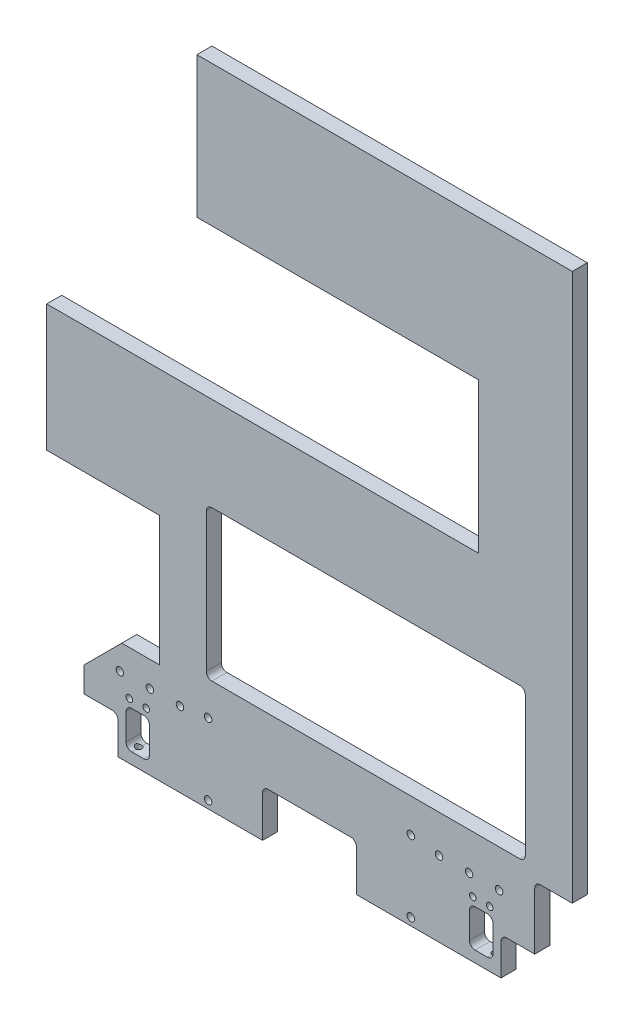
from build123d import *

# Parameters (mm, degrees)
ESQUISSE1_W              = 280
ESQUISSE1_H              = 45
BOSS_EXTRU_1_DEPTH       = 8
ESQUISSE3_W              = 38
ESQUISSE3_H              = 20
ENL_V_MAT_EXTRU_2_DEPTH  = 284.705833567
ESQUISSE2_R              = 2
ENL_V_MAT_EXTRU_1_DEPTH  = 284.705833567
ESQUISSE4_R              = 2
ESQUISSE4_R_2            = 1.75
ESQUISSE4_W              = 12.5
ESQUISSE4_H              = 20
ENL_V_MAT_EXTRU_3_DEPTH  = 284.705833567
ESQUISSE5_R              = 1.65
ENL_V_MAT_EXTRU_4_DEPTH  = 10
ESQUISSE6_W              = 50
ESQUISSE6_H              = 25
ENL_V_MAT_EXTRU_5_DEPTH  = 284.705833567
ESQUISSE7_W              = 280
ESQUISSE7_H              = 300
BOSS_EXTRU_2_DEPTH       = 8
ESQUISSE8_W              = 170
ESQUISSE8_H              = 80
ENL_V_MAT_EXTRU_6_DEPTH  = 445.397344727
ESQUISSE9_W              = 60
ESQUISSE9_H              = 69
ENL_V_MAT_EXTRU_7_DEPTH  = 445.397344727
ESQUISSE10_W             = 20
ESQUISSE10_H             = 33.5
ENL_V_MAT_EXTRU_8_DEPTH  = 445.397344727
CHANFREIN1_SIZE          = 20
CONG_1_R                 = 3
ESQUISSE11_W             = 230
ESQUISSE11_H             = 80
ENL_V_MAT_EXTRU_9_DEPTH  = 445.397344728
ESQUISSE12_W             = 80
ESQUISSE12_H             = 75
ENL_V_MAT_EXTRU_10_DEPTH = 445.397344728


with BuildPart() as part:
    # Esquisse1 → Boss.-Extru.1 (new body)
    with BuildSketch(Plane.XY):
        with Locations((140, 22.5)):
            Rectangle(ESQUISSE1_W, ESQUISSE1_H)
    extrude(amount=BOSS_EXTRU_1_DEPTH)

    # Esquisse3 → Enlèv. mat.-Extru.2 (cut, through all)
    with BuildSketch(Plane.XY.offset(8)):
        with Locations((19, 10)):
            Rectangle(ESQUISSE3_W, ESQUISSE3_H)
        with Locations((261, 10)):
            Rectangle(ESQUISSE3_W, ESQUISSE3_H)
    extrude(amount=-ENL_V_MAT_EXTRU_2_DEPTH, mode=Mode.SUBTRACT)

    # Esquisse2 → Enlèv. mat.-Extru.1 (cut, through all)
    with BuildSketch(Plane.XY.offset(8)):
        with Locations((86, 4)):
            Circle(ESQUISSE2_R)
        with Locations((86, 42)):
            Circle(ESQUISSE2_R)
        with Locations(Location((194, 42, 0), (0, 0, 180))):
            Circle(ESQUISSE2_R)
        with Locations(Location((194, 4, 0), (0, 0, 180))):
            Circle(ESQUISSE2_R)
    extrude(amount=-ENL_V_MAT_EXTRU_1_DEPTH, mode=Mode.SUBTRACT)

    # Esquisse4 → Enlèv. mat.-Extru.3 (cut, through all)
    with BuildSketch(Plane.XY.offset(8)):
        with Locations((71, 40)):
            Circle(ESQUISSE4_R)
        with Locations((39, 40)):
            Circle(ESQUISSE4_R)
        with Locations((55, 40)):
            Circle(ESQUISSE4_R)
        with Locations(Location((225, 40, 0), (0, 0, 180))):
            Circle(ESQUISSE4_R)
        with Locations(Location((241, 40, 0), (0, 0, 180))):
            Circle(ESQUISSE4_R)
        with Locations(Location((209, 40, 0), (0, 0, 180))):
            Circle(ESQUISSE4_R)
        with Locations((236, 30)):
            Circle(ESQUISSE4_R_2)
        with Locations((227, 30)):
            Circle(ESQUISSE4_R_2)
        with Locations(Location((53, 30, 0), (0, 0, 180))):
            Circle(ESQUISSE4_R_2)
        with Locations(Location((44, 30, 0), (0, 0, 180))):
            Circle(ESQUISSE4_R_2)
        with Locations((231.5, 16)):
            Rectangle(ESQUISSE4_W, ESQUISSE4_H)
        with Locations((48.5, 16)):
            Rectangle(ESQUISSE4_W, ESQUISSE4_H)
    extrude(amount=-ENL_V_MAT_EXTRU_3_DEPTH, mode=Mode.SUBTRACT)

    # Esquisse5 → Enlèv. mat.-Extru.4 (cut)
    with BuildSketch(Plane(origin=(0, 0, 0), x_dir=(-1, 0, 0), z_dir=(0, -1, 0))):
        with Locations(Location((-180, -4, 0), (0, 0, 90))):
            Circle(ESQUISSE5_R)
        with Locations(Location((-235, -4, 0), (0, 0, 90))):
            Circle(ESQUISSE5_R)
        with Locations(Location((-45, -4, 0), (0, 0, 90))):
            Circle(ESQUISSE5_R)
        with Locations(Location((-100, -4, 0), (0, 0, 270))):
            Circle(ESQUISSE5_R)
    extrude(amount=-ENL_V_MAT_EXTRU_4_DEPTH, mode=Mode.SUBTRACT)

    # Esquisse6 → Enlèv. mat.-Extru.5 (cut, through all)
    with BuildSketch(Plane(origin=(0, 0, 0), x_dir=(-1, 0, 0), z_dir=(0, 0, -1))):
        with Locations((-140, 12.5)):
            Rectangle(ESQUISSE6_W, ESQUISSE6_H)
    extrude(amount=-ENL_V_MAT_EXTRU_5_DEPTH, mode=Mode.SUBTRACT)

    # Esquisse7 → Boss.-Extru.2 (add)
    with BuildSketch(Plane.XY.offset(8)):
        with Locations((140, 195)):
            Rectangle(ESQUISSE7_W, ESQUISSE7_H)
    extrude(amount=-BOSS_EXTRU_2_DEPTH)

    # Esquisse8 → Enlèv. mat.-Extru.6 (cut, through all)
    with BuildSketch(Plane.XY.offset(8)):
        with Locations((170, 100)):
            Rectangle(ESQUISSE8_W, ESQUISSE8_H)
    extrude(amount=-ENL_V_MAT_EXTRU_6_DEPTH, mode=Mode.SUBTRACT)

    # Esquisse9 → Enlèv. mat.-Extru.7 (cut, through all)
    with BuildSketch(Plane.XY.offset(8)):
        with Locations((30, 88)):
            Rectangle(ESQUISSE9_W, ESQUISSE9_H)
    extrude(amount=-ENL_V_MAT_EXTRU_7_DEPTH, mode=Mode.SUBTRACT)

    # Esquisse10 → Enlèv. mat.-Extru.8 (cut, through all)
    with BuildSketch(Plane.XY.offset(8)):
        with Locations((10, 36.75)):
            Rectangle(ESQUISSE10_W, ESQUISSE10_H)
        with Locations((270, 36.75)):
            Rectangle(ESQUISSE10_W, ESQUISSE10_H)
    extrude(amount=-ENL_V_MAT_EXTRU_8_DEPTH, mode=Mode.SUBTRACT)

    # Chanfrein1
    chanfrein1_edges = [part.edges().sort_by_distance(p)[0] for p in [
        (20, 53.5, 4),
    ]]
    chamfer(chanfrein1_edges, length=CHANFREIN1_SIZE)

    # Congé1
    # the kernel refuses this fillet: 3 mm, written as the material it adds along each edge
    with BuildSketch(Plane(origin=(165, 25, 0), x_dir=(-1, 0, 0), z_dir=(0, 0, 1)), Plane(origin=(115, 25, 0), x_dir=(0, -1, 0), z_dir=(0, 0, 1)), Plane(origin=(85, 60, 8), x_dir=(0, 1, 0), z_dir=(0, 0, -1)), Plane(origin=(255, 60, 8), x_dir=(-1, 0, 0), z_dir=(0, 0, -1)), Plane(origin=(260, 53.5, 8), x_dir=(1, 0, 0), z_dir=(0, 0, -1)), Plane(origin=(54.75, 6, 8), x_dir=(-1, 0, 0), z_dir=(0, 0, -1)), Plane(origin=(225.25, 6, 8), x_dir=(0, 1, 0), z_dir=(0, 0, -1))) as cong_1_piece_1:
        with BuildLine():
            CenterArc((CONG_1_R, CONG_1_R), CONG_1_R, 180, 90)
            Line((0, CONG_1_R), (0, 0))
            Line((0, 0), (CONG_1_R, 0))
        make_face()
    extrude(amount=8)
    with BuildSketch(Plane(origin=(38, 20, 8), x_dir=(-1, 0, 0), z_dir=(0, 0, -1)), Plane(origin=(85, 140, 8), x_dir=(0, -1, 0), z_dir=(0, 0, -1)), Plane(origin=(255, 140, 8), x_dir=(-1, 0, 0), z_dir=(0, 0, -1)), Plane(origin=(242, 20, 8), x_dir=(0, -1, 0), z_dir=(0, 0, -1)), Plane(origin=(42.25, 26, 8), x_dir=(0, -1, 0), z_dir=(0, 0, -1)), Plane(origin=(54.75, 26, 8), x_dir=(-1, 0, 0), z_dir=(0, 0, -1)), Plane(origin=(225.25, 26, 8), x_dir=(0, -1, 0), z_dir=(0, 0, -1)), Plane(origin=(237.75, 26, 8), x_dir=(-1, 0, 0), z_dir=(0, 0, -1))) as cong_1_piece_2:
        with BuildLine():
            CenterArc((CONG_1_R, -CONG_1_R), CONG_1_R, 90, 90)
            Line((0, -CONG_1_R), (0, 0))
            Line((0, 0), (CONG_1_R, 0))
        make_face()
    extrude(amount=8)
    with BuildSketch(Plane(origin=(42.25, 6, 8), x_dir=(0, 1, 0), z_dir=(0, 0, -1))) as cong_1_piece_3_section:
        with BuildLine():
            CenterArc((CONG_1_R, CONG_1_R), CONG_1_R, 180, 90)
            Line((0, CONG_1_R), (0, 0))
            Line((0, 0), (CONG_1_R, 0))
        make_face()
    cong_1_piece_3 = extrude(amount=8, mode=Mode.PRIVATE)
    cong_1_piece_3 = cong_1_piece_3 - Plane(origin=(45, 6.716481704, 4), x_dir=(0, 0, -1), z_dir=(0, -1, 0)) * Cylinder(1.65, 29, mode=Mode.PRIVATE)
    add(cong_1_piece_3)
    with BuildSketch(Plane(origin=(237.75, 6, 8), x_dir=(-1, 0, 0), z_dir=(0, 0, -1))) as cong_1_piece_4_section:
        with BuildLine():
            CenterArc((CONG_1_R, CONG_1_R), CONG_1_R, 180, 90)
            Line((0, CONG_1_R), (0, 0))
            Line((0, 0), (CONG_1_R, 0))
        make_face()
    cong_1_piece_4 = extrude(amount=8, mode=Mode.PRIVATE)
    cong_1_piece_4 = cong_1_piece_4 - Plane(origin=(235, 6.716481615, 4), x_dir=(0, 0, -1), z_dir=(0, -1, 0)) * Cylinder(1.65, 29, mode=Mode.PRIVATE)
    add(cong_1_piece_4)

    # Esquisse11 → Enlèv. mat.-Extru.9 (cut, through all)
    with BuildSketch(Plane.XY.offset(8)):
        with Locations((115, 230)):
            Rectangle(ESQUISSE11_W, ESQUISSE11_H)
    extrude(amount=-ENL_V_MAT_EXTRU_9_DEPTH, mode=Mode.SUBTRACT)

    # Esquisse12 → Enlèv. mat.-Extru.10 (cut, through all)
    with BuildSketch(Plane.XY.offset(8)):
        with Locations((40, 307.5)):
            Rectangle(ESQUISSE12_W, ESQUISSE12_H)
    extrude(amount=-ENL_V_MAT_EXTRU_10_DEPTH, mode=Mode.SUBTRACT)


solid = part.part
